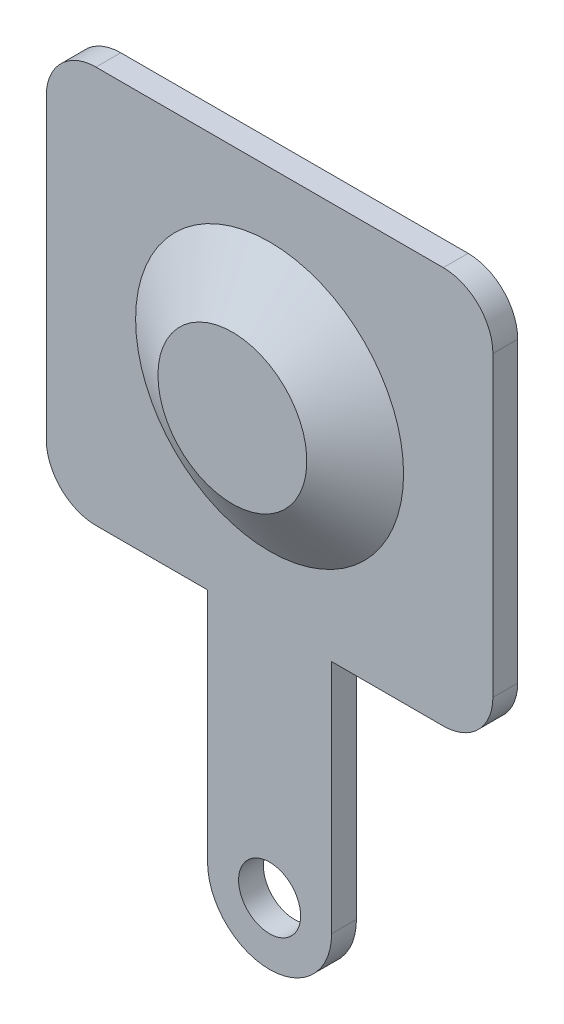
from build123d import *

# Parameters (mm, degrees)
SKETCH1_W           = 9
SKETCH1_H           = 8
BOSS_EXTRUDE1_DEPTH = 0.5
BOSS_EXTRUDE2_DEPTH = 0.5
FILLET1_R           = 1
SKETCH4_R           = 0.625
CUT_EXTRUDE1_DEPTH  = 11.9772492


# Read off the part's stored shape, not the designer's step: Shell1
with BuildPart() as part:
    # Sketch1 → Boss-Extrude1 (new body)
    with BuildSketch(Plane.XY):
        Rectangle(SKETCH1_W, SKETCH1_H)
    extrude(amount=BOSS_EXTRUDE1_DEPTH)

    # Sketch2 → Boss-Extrude2 (add)
    with BuildSketch(Plane.XY):
        with BuildLine():
            Line((1.25, 0), (1.25, -8.75))
            ThreePointArc((1.25, -8.75), (0, -10), (-1.25, -8.75))
            Line((-1.25, -8.75), (-1.25, 0))
            ThreePointArc((-1.25, 0), (0, 1.25), (1.25, 0))
        make_face()
    extrude(amount=BOSS_EXTRUDE2_DEPTH)

    # Fillet1
    fillet1_edges = [part.edges().sort_by_distance(p)[0] for p in [
        (4.5, -4, 0.25),
        (-4.5, -4, 0.25),
        (-4.5, 4, 0.25),
        (4.5, 4, 0.25),
    ]]
    fillet(fillet1_edges, radius=FILLET1_R)

    # Sketch4 → Cut-Extrude1 (cut, through all)
    with BuildSketch(Plane.XY.offset(0.5)):
        with Locations((0, -8.75)):
            Circle(SKETCH4_R)
    extrude(amount=-CUT_EXTRUDE1_DEPTH, mode=Mode.SUBTRACT)

    # Sketch5 → Revolve1 (revolve)
    with BuildSketch(Plane(origin=(0, 0, 0), x_dir=(1, 0, 0), z_dir=(0, 1, 0)), mode=Mode.PRIVATE) as revolve1_sk:
        Polygon((0, -0.5), (2.7, -0.5), (1.5, -1.25), (0, -1.25), align=None)
    revolve(revolve1_sk.sketch.rotate(Axis((0, 0, -88.99), (0, 0, 1)), 180), axis=Axis((0, 0, -88.99), (0, 0, 1)))

    # Shell1 outline → Shell1 (revolve, cut)
    with BuildSketch(Plane.XZ):
        Polygon((2.556601887, 0), (1.356601887, 0.75), (0, 0.75), (0, 0), align=None)
    revolve(axis=Axis((0, 0, 0), (0, 0, 1)), mode=Mode.SUBTRACT)


solid = part.part
